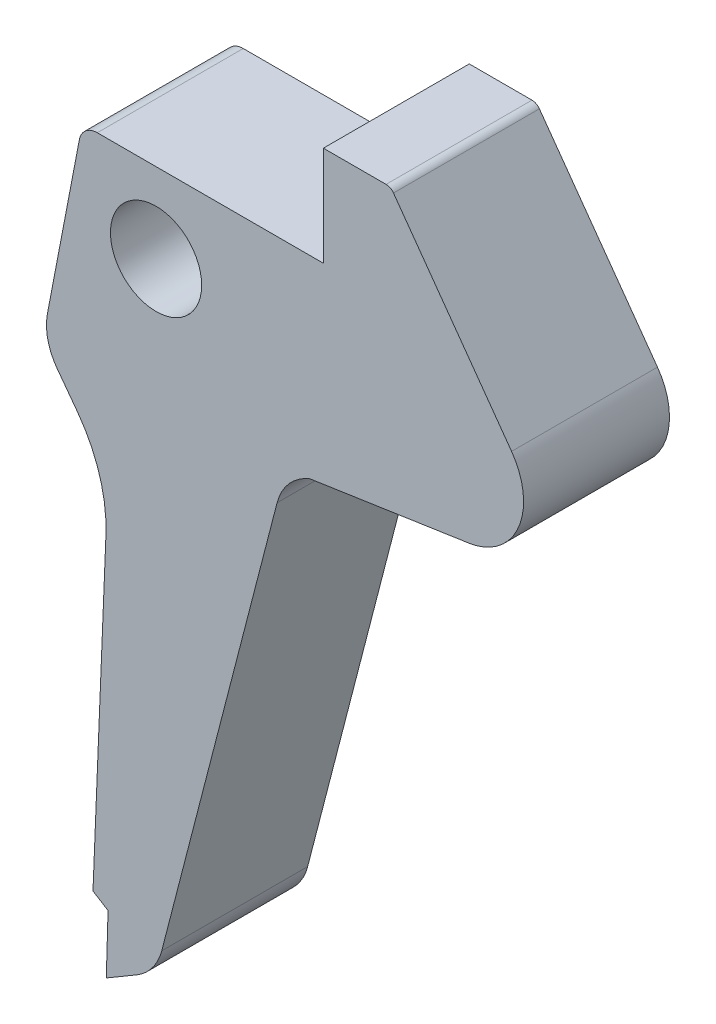
from build123d import *

# Parameters (mm, degrees)
SKETCH_1_R          = 2.5
EXTRUDE_1_DEPTH     = 8
SKETCH_4_R          = 2.25
CUT_EXTRUDE_2_DEPTH = 3
SKETCH_6_R          = 1.725
EXTRUDE_2_DEPTH     = 4
FILLET_6_R          = 1


with BuildPart() as part:
    # 스케치1 → 보스-돌출1 (new body)
    with BuildSketch(Plane.XY):
        with BuildLine():
            Line((-50.12997125, 16.381071694), (-48.377887322, 25.52402875))
            ThreePointArc((-48.377887322, 25.52402875), (-48.032857913, 26.10660252), (-47.395758032, 26.335821266))
            Line((-47.395758032, 26.335821266), (-35.000835835, 26.335821266))
            Line((-35.000835835, 26.335821266), (-35.000835835, 31.800366955))
            Line((-35.000835835, 31.800366955), (-31.562203109, 31.800366955))
            ThreePointArc((-31.562203109, 31.800366955), (-31.333811868, 31.745156164), (-31.155859271, 31.591716719))
            Line((-31.155859271, 31.591716719), (-24.681060838, 22.561352637))
            ThreePointArc((-24.681060838, 22.561352637), (-24.300211664, 19.142663028), (-27.018632433, 17.034898037))
            Line((-27.018632433, 17.034898037), (-35.743375686, 15.730240751))
            ThreePointArc((-35.743375686, 15.730240751), (-36.884031614, 14.926959864), (-37.53802859, 13.694627083))
            Line((-37.53802859, 13.694627083), (-43.863021593, -10.745849723))
            ThreePointArc((-43.863021593, -10.745849723), (-44.371730052, -11.800071767), (-45.245148695, -12.579371638))
            Line((-45.245148695, -12.579371638), (-46.902558861, -13.555296504))
            Line((-46.902558861, -13.555296504), (-46.806577136, -10.304272722))
            Line((-46.806577136, -10.304272722), (-47.632712219, -9.790607342))
            Line((-47.632712219, -9.790607342), (-46.923209509, 7.455978458))
            ThreePointArc((-46.923209509, 7.455978458), (-47.273115569, 10.146898587), (-48.502421166, 12.566049913))
            Line((-48.502421166, 12.566049913), (-49.588843633, 14.023484347))
            ThreePointArc((-49.588843633, 14.023484347), (-50.107551391, 15.14532253), (-50.12997125, 16.381071694))
        make_face()
        with Locations((-44.17435031, 21.9571758)):
            Circle(SKETCH_1_R, mode=Mode.SUBTRACT)
    extrude(amount=EXTRUDE_1_DEPTH)

    # 스케치4 → 컷-돌출2 (cut)
    with BuildSketch(Plane(origin=(0, 16.335821266, 0), x_dir=(1, 0, 0), z_dir=(0, 1, 0))):
        with Locations((-29.199818247, -4)):
            Circle(SKETCH_4_R)
    extrude(amount=CUT_EXTRUDE_2_DEPTH, mode=Mode.SUBTRACT)

    # 스케치6 → 보스-돌출2 (add)
    with BuildSketch(Plane.XZ.offset(-19.335821266)):
        with Locations((-29.199818247, 4)):
            Circle(SKETCH_6_R)
    extrude(amount=EXTRUDE_2_DEPTH)

    # 필렛6
    fillet_6_edges = [part.edges().sort_by_distance(p)[0] for p in [
        (-30.924818247, 15.335821266, 4),
    ]]
    fillet(fillet_6_edges, radius=FILLET_6_R)


solid = part.part
